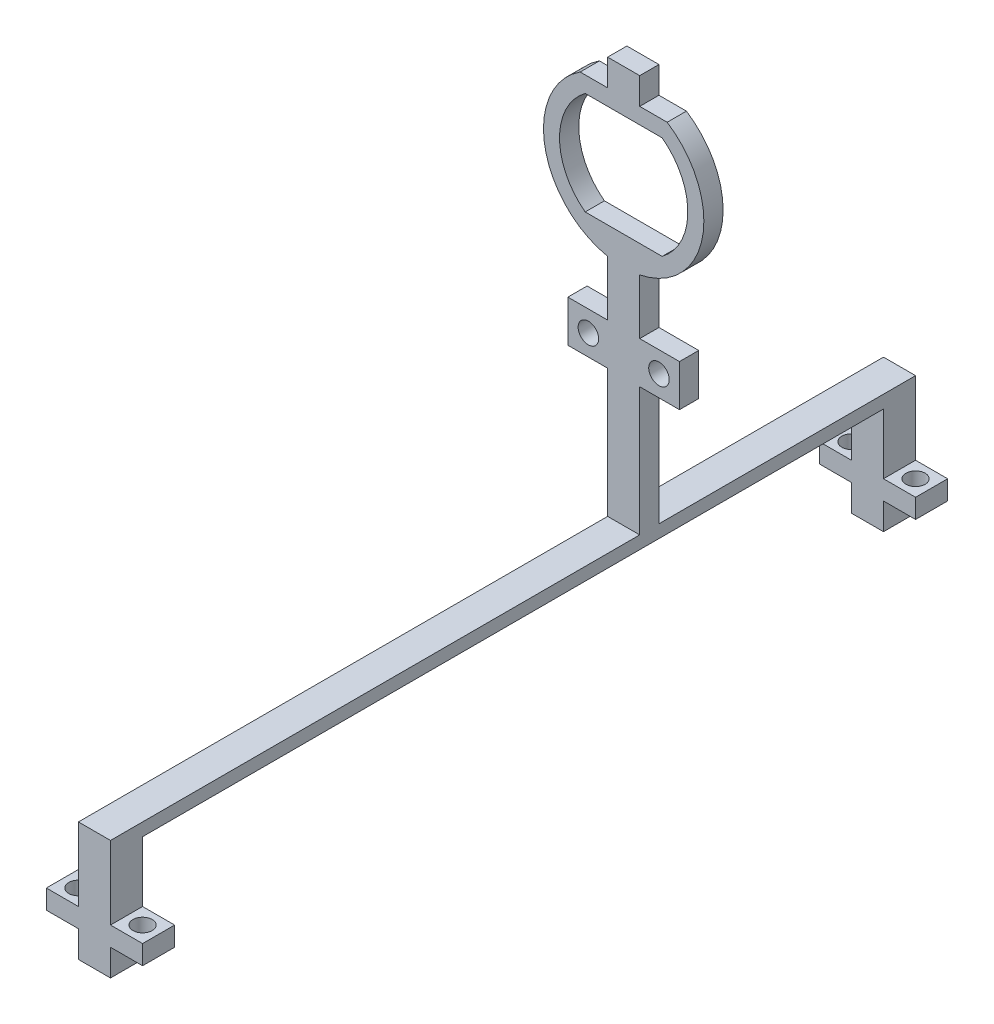
from build123d import *

# Parameters (mm, degrees)
BOSS_EXTRUDE1_DEPTH     = 3
SKETCH3_W               = 17.4
SKETCH3_H               = 6.5
SKETCH3_R               = 1.6
BOSS_EXTRUDE4_DEPTH     = 3
SKETCH11_W              = 5
SKETCH11_H              = 3
BOSS_EXTRUDE8_DEPTH     = 4.15
SKETCH6_W               = 5
SKETCH6_H               = 2
BOSS_EXTRUDE5_DEPTH     = 40
SKETCH10_W              = 5
SKETCH10_H              = 2
BOSS_EXTRUDE7_DEPTH     = 82.49
BOSS_EXTRUDE9_DEPTH     = 5
SKETCH15_R              = 1.5
CUT_EXTRUDE1_DEPTH      = 5
MIRROR2_COPY_1_SKETCH_R = 1.5
MIRROR2_COPY_1_DEPTH    = 5


with BuildPart() as part:
    # Sketch1 → Boss-Extrude1 (new body)
    with BuildSketch(Plane.XY):
        with BuildLine():
            Line((-2.5, -49.347448714), (2.5, -49.347448714))
            Line((2.5, -49.347448714), (2.5, -12.247448714))
            ThreePointArc((2.5, -12.247448714), (12.284218259, -2.312570382), (6.782329983, 10.5))
            Line((6.782329983, 10.5), (-6.782329983, 10.5))
            ThreePointArc((-6.782329983, 10.5), (-12.284218259, -2.312570382), (-2.5, -12.247448714))
            Line((-2.5, -12.247448714), (-2.5, -49.347448714))
        make_face()
        with BuildLine():
            Line((6, -8), (-6, -8))
            ThreePointArc((-6, -8), (-10, 0), (-6, 8))
            Line((-6, 8), (6, 8))
            ThreePointArc((6, 8), (10, 0), (6, -8))
        make_face(mode=Mode.SUBTRACT)
    extrude(amount=BOSS_EXTRUDE1_DEPTH)

    # Sketch3 → Boss-Extrude4 (add)
    with BuildSketch(Plane.XY):
        with Locations((0, -24.097448714)):
            Rectangle(SKETCH3_W, SKETCH3_H)
        with Locations((-5.5, -24.097448714)):
            Circle(SKETCH3_R, mode=Mode.SUBTRACT)
        with Locations((5.5, -24.097448714)):
            Circle(SKETCH3_R, mode=Mode.SUBTRACT)
    extrude(amount=BOSS_EXTRUDE4_DEPTH)

    # Sketch11 → Boss-Extrude8 (add)
    with BuildSketch(Plane(origin=(0, 10.5, 0), x_dir=(1, 0, 0), z_dir=(0, 1, 0))):
        with Locations((0, -1.5)):
            Rectangle(SKETCH11_W, SKETCH11_H)
    extrude(amount=BOSS_EXTRUDE8_DEPTH)

    # Sketch6 → Boss-Extrude5 (add)
    with BuildSketch(Plane(origin=(0, 0, 0), x_dir=(-1, 0, 0), z_dir=(0, 0, -1))):
        with Locations((0, -48.347448714)):
            Rectangle(SKETCH6_W, SKETCH6_H)
    extrude(amount=BOSS_EXTRUDE5_DEPTH)

    # Sketch10 → Boss-Extrude7 (add)
    with BuildSketch(Plane.XY.offset(3)):
        with Locations((0, -48.347448714)):
            Rectangle(SKETCH10_W, SKETCH10_H)
    extrude(amount=BOSS_EXTRUDE7_DEPTH)

    # Sketch14 → Boss-Extrude9 (add)
    with BuildSketch(Plane(origin=(0, 0, -40), x_dir=(-1, 0, 0), z_dir=(0, 0, -1))):
        Polygon((-2.5, -61.767448714), (-2.5, -65.917448714), (2.5, -65.917448714), (2.5, -61.767448714), (7.5, -61.767448714), (7.5, -58.767448714), (2.5, -58.767448714), (2.5, -49.347448714), (-2.5, -49.347448714), (-2.5, -58.767448714), (-7.5, -58.767448714), (-7.5, -61.767448714), align=None)
    boss_extrude9 = extrude(amount=-BOSS_EXTRUDE9_DEPTH)

    # Sketch15 → Cut-Extrude1 (cut)
    with BuildSketch(Plane(origin=(0, -58.767448714, 0), x_dir=(1, 0, 0), z_dir=(0, 1, 0))):
        with Locations((-5, 37.5)):
            Circle(SKETCH15_R)
    cut_extrude1 = extrude(amount=-CUT_EXTRUDE1_DEPTH, mode=Mode.SUBTRACT)

    # Mirror1: Cut-Extrude1 across plane
    add(cut_extrude1.mirror(Plane(origin=(0, 0, 0), x_dir=(0, 0, 1), z_dir=(1, 0, 0))), mode=Mode.SUBTRACT)

    # Mirror2: Boss-Extrude9, Cut-Extrude1 across plane
    add(boss_extrude9.mirror(Plane(origin=(0, 0, 22.745), x_dir=(1, 0, 0), z_dir=(0, 0, -1))))
    add(cut_extrude1.mirror(Plane(origin=(0, 0, 22.745), x_dir=(1, 0, 0), z_dir=(0, 0, -1))), mode=Mode.SUBTRACT)

    # Mirror2 copy 1 sketch → Mirror2 copy 1 (cut)
    with BuildSketch(Plane(origin=(0, -58.767448714, 45.49), x_dir=(-1, 0, 0), z_dir=(0, 1, 0))):
        with Locations((-5, 37.5)):
            Circle(MIRROR2_COPY_1_SKETCH_R)
    extrude(amount=-MIRROR2_COPY_1_DEPTH, mode=Mode.SUBTRACT)


solid = part.part
